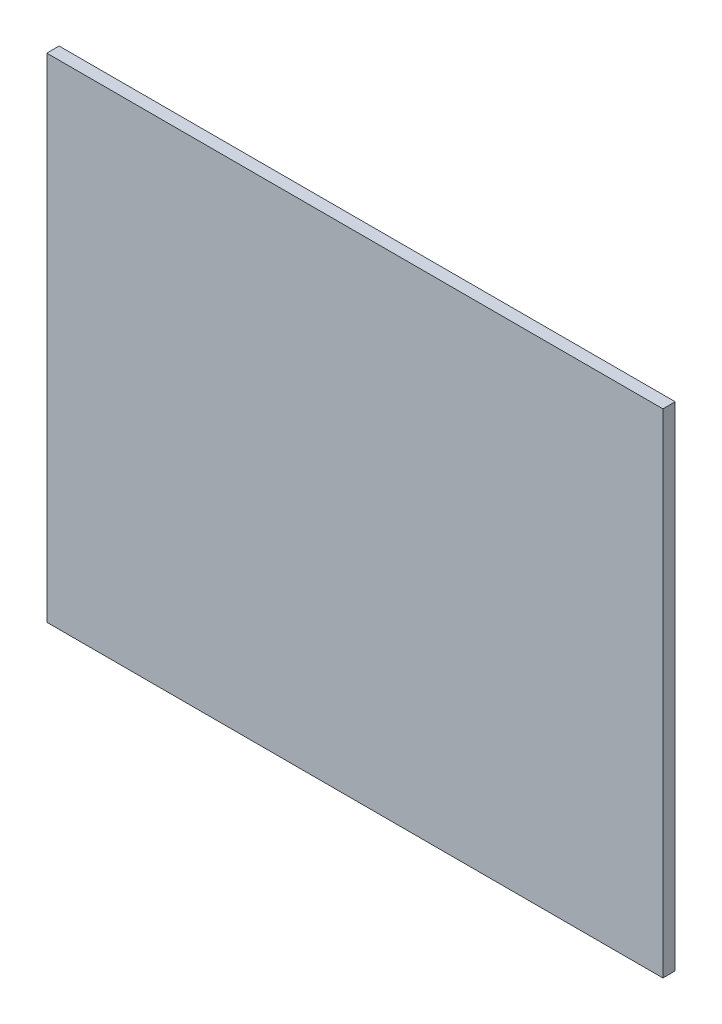
from build123d import *

# Parameters (mm, degrees)
ESQUISSE1_W        = 500
ESQUISSE1_H        = 400
BOSS_EXTRU_1_DEPTH = 10


with BuildPart() as part:
    # Esquisse1 → Boss.-Extru.1 (new body)
    with BuildSketch(Plane.XY):
        Rectangle(ESQUISSE1_W, ESQUISSE1_H)
    extrude(amount=BOSS_EXTRU_1_DEPTH)


solid = part.part
